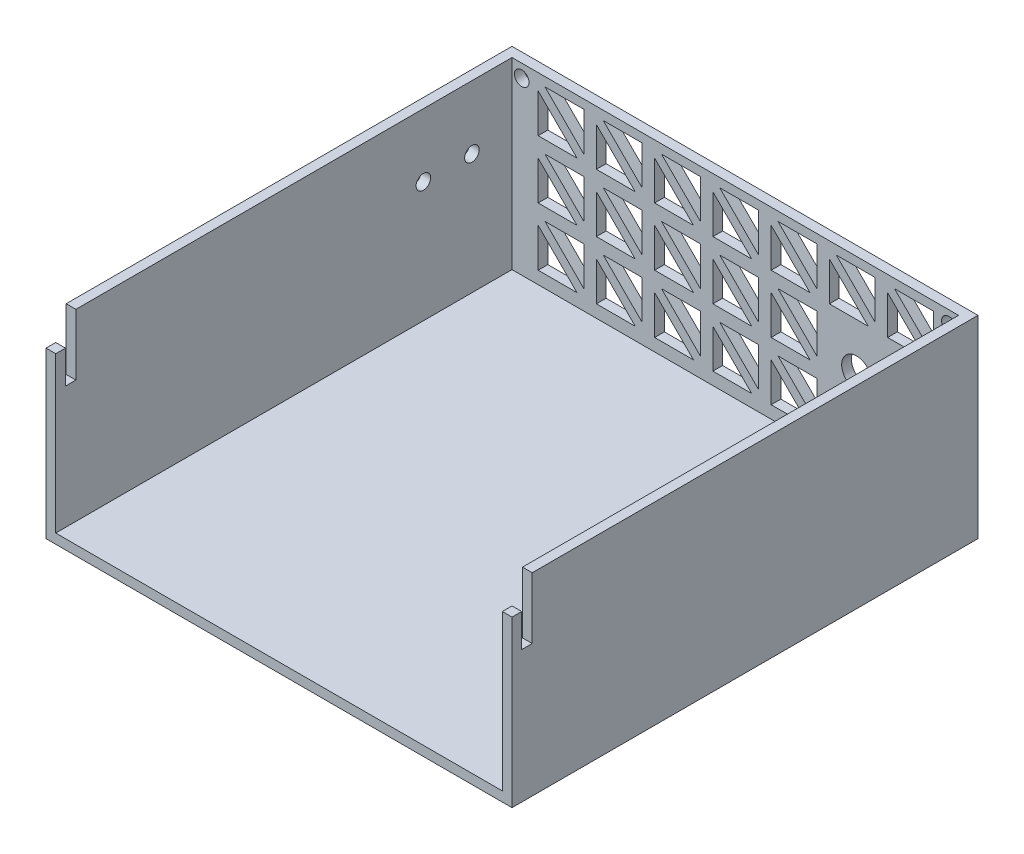
from build123d import *

# Parameters (mm, degrees)
SKETCH1_W           = 152.4
SKETCH1_H           = 152.4
BOSS_EXTRUDE1_DEPTH = 247.65
SHELL1_T            = -3.175
SKETCH3_W           = 152.4
SKETCH3_H           = 3.4798
SKETCH3_H_2         = 4.064
CUT_EXTRUDE1_DEPTH  = 117.475
SKETCH4_W           = 6.604
SKETCH4_H           = 6.7564
SKETCH4_W_2         = 3.429
SKETCH4_H_2         = 10.7696
CUT_EXTRUDE2_DEPTH  = 329.30175525
CUT_EXTRUDE3_REACH  = 330.302
SKETCH5_R           = 4.8895
CUT_EXTRUDE4_DEPTH  = 3.175
CUT_EXTRUDE5_REACH  = 330.302
SKETCH7_R           = 2.38125
SKETCH7_2_R         = 2.38125
CUT_EXTRUDE6_DEPTH  = 329.30175525
SKETCH8_R           = 2.38125
CUT_EXTRUDE8_DEPTH  = 327.839996214
SKETCH9_W           = 186.937602099
SKETCH9_H           = 189.555736562
CUT_EXTRUDE9_DEPTH  = 329.30175525


with BuildPart() as part:
    # Sketch1 → Boss-Extrude1 (new body)
    with BuildSketch(Plane(origin=(0, 0, 0), x_dir=(1, 0, 0), z_dir=(0, 1, 0))):
        with Locations((76.2, 76.2)):
            Rectangle(SKETCH1_W, SKETCH1_H)
    extrude(amount=BOSS_EXTRUDE1_DEPTH)

    # Shell1
    shell1_openings = [part.faces().sort_by_distance(p)[0] for p in [
        (76.2, 247.65, -76.2),
        (76.2, 123.825, 0),
    ]]
    offset(amount=SHELL1_T, openings=shell1_openings, kind=Kind.INTERSECTION)

    # Sketch3 → Cut-Extrude1 (cut)
    with BuildSketch(Plane.XY.offset(-117.475)):
        with Locations((76.2, 68.4149)):
            Rectangle(SKETCH3_W, SKETCH3_H)
        with Locations((76.2, 238.8616)):
            Rectangle(SKETCH3_W, SKETCH3_H_2)
        with Locations((76.2, 193.8147)):
            Rectangle(SKETCH3_W, SKETCH3_H)
    extrude(amount=CUT_EXTRUDE1_DEPTH, mode=Mode.SUBTRACT)

    # Sketch4 → Cut-Extrude2 (cut, through all)
    with BuildSketch(Plane(origin=(152.4, 0, 0), x_dir=(0, 0, -1), z_dir=(1, 0, 0))):
        with Locations((3.302, 244.2718)):
            Rectangle(SKETCH4_W, SKETCH4_H)
        with Locations((4.8895, 231.4448)):
            Rectangle(SKETCH4_W_2, SKETCH4_H_2)
        Polygon((6.604, 66.675), (6.604, 43.2054), (3.175, 43.2054), (3.175, 53.975), (0, 53.975), (0, 66.675), align=None)
        Polygon((3.175, 147.32), (3.175, 137.16), (6.604, 137.16), (6.604, 160.528), (0, 160.528), (0, 147.32), align=None)
    extrude(amount=-CUT_EXTRUDE2_DEPTH, mode=Mode.SUBTRACT)

    # Sketch5 → Cut-Extrude3 (cut, up to next)
    with BuildSketch(Plane(origin=(0, 0, -152.4), x_dir=(-1, 0, 0), z_dir=(0, 0, -1)), mode=Mode.PRIVATE) as cut_extrude3_sk1:
        with Locations((-115.8748, 30.1752)):
            Circle(SKETCH5_R)
    cut_extrude3_tool1 = extrude(cut_extrude3_sk1.sketch, amount=-CUT_EXTRUDE3_REACH, mode=Mode.PRIVATE) & part.part
    add(cut_extrude3_tool1.solids().sort_by_distance((115.8748, 30.1752, -152.4))[0], mode=Mode.SUBTRACT)

    # Sketch6 → Cut-Extrude4 (cut)
    with BuildSketch(Plane.XY.offset(-149.225)):
        Polygon((140.97, 192.0748), (140.97, 179.3748), (128.27, 192.0748), align=None)
        Polygon((138.72493597, 177.12973597), (126.02493597, 189.82973597), (126.02493597, 177.12973597), align=None)
        Polygon((140.97, 174.2948), (140.97, 161.5948), (128.27, 174.2948), align=None)
        Polygon((138.72493597, 159.34973597), (126.02493597, 172.04973597), (126.02493597, 159.34973597), align=None)
        Polygon((140.97, 156.5148), (140.97, 143.8148), (128.27, 156.5148), align=None)
        Polygon((138.72493597, 141.56973597), (126.02493597, 154.26973597), (126.02493597, 141.56973597), align=None)
        Polygon((140.97, 138.7348), (140.97, 126.0348), (128.27, 138.7348), align=None)
        Polygon((138.72493597, 123.78973597), (126.02493597, 136.48973597), (126.02493597, 123.78973597), align=None)
        Polygon((140.97, 120.9548), (140.97, 108.2548), (128.27, 120.9548), align=None)
        Polygon((138.72493597, 106.00973597), (126.02493597, 118.70973597), (126.02493597, 106.00973597), align=None)
        Polygon((140.97, 103.1748), (140.97, 90.4748), (128.27, 103.1748), align=None)
        Polygon((138.72493597, 88.22973597), (126.02493597, 100.92973597), (126.02493597, 88.22973597), align=None)
        Polygon((140.97, 85.3948), (140.97, 72.6948), (128.27, 85.3948), align=None)
        Polygon((138.72493597, 70.44973597), (126.02493597, 83.14973597), (126.02493597, 70.44973597), align=None)
        Polygon((121.92, 192.0748), (121.92, 179.3748), (109.22, 192.0748), align=None)
        Polygon((119.67493597, 177.12973597), (106.97493597, 189.82973597), (106.97493597, 177.12973597), align=None)
        Polygon((121.92, 174.2948), (121.92, 161.5948), (109.22, 174.2948), align=None)
        Polygon((119.67493597, 159.34973597), (106.97493597, 172.04973597), (106.97493597, 159.34973597), align=None)
        Polygon((121.92, 156.5148), (121.92, 143.8148), (109.22, 156.5148), align=None)
        Polygon((119.67493597, 141.56973597), (106.97493597, 154.26973597), (106.97493597, 141.56973597), align=None)
        Polygon((121.92, 138.7348), (121.92, 126.0348), (109.22, 138.7348), align=None)
        Polygon((119.67493597, 123.78973597), (106.97493597, 136.48973597), (106.97493597, 123.78973597), align=None)
        Polygon((121.92, 120.9548), (121.92, 108.2548), (109.22, 120.9548), align=None)
        Polygon((119.67493597, 106.00973597), (106.97493597, 118.70973597), (106.97493597, 106.00973597), align=None)
        Polygon((121.92, 103.1748), (121.92, 90.4748), (109.22, 103.1748), align=None)
        Polygon((119.67493597, 88.22973597), (106.97493597, 100.92973597), (106.97493597, 88.22973597), align=None)
        Polygon((121.92, 85.3948), (121.92, 72.6948), (109.22, 85.3948), align=None)
        Polygon((119.67493597, 70.44973597), (106.97493597, 83.14973597), (106.97493597, 70.44973597), align=None)
        Polygon((102.87, 192.0748), (102.87, 179.3748), (90.17, 192.0748), align=None)
        Polygon((100.62493597, 177.12973597), (87.92493597, 189.82973597), (87.92493597, 177.12973597), align=None)
        Polygon((102.87, 174.2948), (102.87, 161.5948), (90.17, 174.2948), align=None)
        Polygon((100.62493597, 159.34973597), (87.92493597, 172.04973597), (87.92493597, 159.34973597), align=None)
        Polygon((102.87, 156.5148), (102.87, 143.8148), (90.17, 156.5148), align=None)
        Polygon((100.62493597, 141.56973597), (87.92493597, 154.26973597), (87.92493597, 141.56973597), align=None)
        Polygon((102.87, 138.7348), (102.87, 126.0348), (90.17, 138.7348), align=None)
        Polygon((100.62493597, 123.78973597), (87.92493597, 136.48973597), (87.92493597, 123.78973597), align=None)
        Polygon((102.87, 120.9548), (102.87, 108.2548), (90.17, 120.9548), align=None)
        Polygon((100.62493597, 106.00973597), (87.92493597, 118.70973597), (87.92493597, 106.00973597), align=None)
        Polygon((102.87, 103.1748), (102.87, 90.4748), (90.17, 103.1748), align=None)
        Polygon((100.62493597, 88.22973597), (87.92493597, 100.92973597), (87.92493597, 88.22973597), align=None)
        Polygon((102.87, 85.3948), (102.87, 72.6948), (90.17, 85.3948), align=None)
        Polygon((100.62493597, 70.44973597), (87.92493597, 83.14973597), (87.92493597, 70.44973597), align=None)
        Polygon((83.82, 192.0748), (83.82, 179.3748), (71.12, 192.0748), align=None)
        Polygon((81.57493597, 177.12973597), (68.87493597, 189.82973597), (68.87493597, 177.12973597), align=None)
        Polygon((83.82, 174.2948), (83.82, 161.5948), (71.12, 174.2948), align=None)
        Polygon((81.57493597, 159.34973597), (68.87493597, 172.04973597), (68.87493597, 159.34973597), align=None)
        Polygon((83.82, 156.5148), (83.82, 143.8148), (71.12, 156.5148), align=None)
        Polygon((81.57493597, 141.56973597), (68.87493597, 154.26973597), (68.87493597, 141.56973597), align=None)
        Polygon((83.82, 138.7348), (83.82, 126.0348), (71.12, 138.7348), align=None)
        Polygon((81.57493597, 123.78973597), (68.87493597, 136.48973597), (68.87493597, 123.78973597), align=None)
        Polygon((83.82, 120.9548), (83.82, 108.2548), (71.12, 120.9548), align=None)
        Polygon((81.57493597, 106.00973597), (68.87493597, 118.70973597), (68.87493597, 106.00973597), align=None)
        Polygon((83.82, 103.1748), (83.82, 90.4748), (71.12, 103.1748), align=None)
        Polygon((81.57493597, 88.22973597), (68.87493597, 100.92973597), (68.87493597, 88.22973597), align=None)
        Polygon((83.82, 85.3948), (83.82, 72.6948), (71.12, 85.3948), align=None)
        Polygon((81.57493597, 70.44973597), (68.87493597, 83.14973597), (68.87493597, 70.44973597), align=None)
        Polygon((64.77, 192.0748), (64.77, 179.3748), (52.07, 192.0748), align=None)
        Polygon((62.52493597, 177.12973597), (49.82493597, 189.82973597), (49.82493597, 177.12973597), align=None)
        Polygon((64.77, 174.2948), (64.77, 161.5948), (52.07, 174.2948), align=None)
        Polygon((62.52493597, 159.34973597), (49.82493597, 172.04973597), (49.82493597, 159.34973597), align=None)
        Polygon((64.77, 156.5148), (64.77, 143.8148), (52.07, 156.5148), align=None)
        Polygon((62.52493597, 141.56973597), (49.82493597, 154.26973597), (49.82493597, 141.56973597), align=None)
        Polygon((64.77, 138.7348), (64.77, 126.0348), (52.07, 138.7348), align=None)
        Polygon((62.52493597, 123.78973597), (49.82493597, 136.48973597), (49.82493597, 123.78973597), align=None)
        Polygon((64.77, 120.9548), (64.77, 108.2548), (52.07, 120.9548), align=None)
        Polygon((62.52493597, 106.00973597), (49.82493597, 118.70973597), (49.82493597, 106.00973597), align=None)
        Polygon((64.77, 103.1748), (64.77, 90.4748), (52.07, 103.1748), align=None)
        Polygon((62.52493597, 88.22973597), (49.82493597, 100.92973597), (49.82493597, 88.22973597), align=None)
        Polygon((64.77, 85.3948), (64.77, 72.6948), (52.07, 85.3948), align=None)
        Polygon((62.52493597, 70.44973597), (49.82493597, 83.14973597), (49.82493597, 70.44973597), align=None)
        Polygon((45.72, 192.0748), (45.72, 179.3748), (33.02, 192.0748), align=None)
        Polygon((43.47493597, 177.12973597), (30.77493597, 189.82973597), (30.77493597, 177.12973597), align=None)
        Polygon((45.72, 174.2948), (45.72, 161.5948), (33.02, 174.2948), align=None)
        Polygon((43.47493597, 159.34973597), (30.77493597, 172.04973597), (30.77493597, 159.34973597), align=None)
        Polygon((45.72, 156.5148), (45.72, 143.8148), (33.02, 156.5148), align=None)
        Polygon((43.47493597, 141.56973597), (30.77493597, 154.26973597), (30.77493597, 141.56973597), align=None)
        Polygon((45.72, 138.7348), (45.72, 126.0348), (33.02, 138.7348), align=None)
        Polygon((43.47493597, 123.78973597), (30.77493597, 136.48973597), (30.77493597, 123.78973597), align=None)
        Polygon((45.72, 120.9548), (45.72, 108.2548), (33.02, 120.9548), align=None)
        Polygon((43.47493597, 106.00973597), (30.77493597, 118.70973597), (30.77493597, 106.00973597), align=None)
        Polygon((45.72, 103.1748), (45.72, 90.4748), (33.02, 103.1748), align=None)
        Polygon((43.47493597, 88.22973597), (30.77493597, 100.92973597), (30.77493597, 88.22973597), align=None)
        Polygon((45.72, 85.3948), (45.72, 72.6948), (33.02, 85.3948), align=None)
        Polygon((43.47493597, 70.44973597), (30.77493597, 83.14973597), (30.77493597, 70.44973597), align=None)
        Polygon((26.67, 192.0748), (26.67, 179.3748), (13.97, 192.0748), align=None)
        Polygon((24.42493597, 177.12973597), (11.72493597, 189.82973597), (11.72493597, 177.12973597), align=None)
        Polygon((26.67, 174.2948), (26.67, 161.5948), (13.97, 174.2948), align=None)
        Polygon((24.42493597, 159.34973597), (11.72493597, 172.04973597), (11.72493597, 159.34973597), align=None)
        Polygon((26.67, 156.5148), (26.67, 143.8148), (13.97, 156.5148), align=None)
        Polygon((24.42493597, 141.56973597), (11.72493597, 154.26973597), (11.72493597, 141.56973597), align=None)
        Polygon((26.67, 138.7348), (26.67, 126.0348), (13.97, 138.7348), align=None)
        Polygon((24.42493597, 123.78973597), (11.72493597, 136.48973597), (11.72493597, 123.78973597), align=None)
        Polygon((26.67, 120.9548), (26.67, 108.2548), (13.97, 120.9548), align=None)
        Polygon((24.42493597, 106.00973597), (11.72493597, 118.70973597), (11.72493597, 106.00973597), align=None)
        Polygon((26.67, 103.1748), (26.67, 90.4748), (13.97, 103.1748), align=None)
        Polygon((24.42493597, 88.22973597), (11.72493597, 100.92973597), (11.72493597, 88.22973597), align=None)
        Polygon((26.67, 85.3948), (26.67, 72.6948), (13.97, 85.3948), align=None)
        Polygon((24.42493597, 70.44973597), (11.72493597, 83.14973597), (11.72493597, 70.44973597), align=None)
        Polygon((140.97, 60.325), (140.97, 47.625), (128.27, 60.325), align=None)
        Polygon((126.02493597, 58.07993597), (126.02493597, 45.37993597), (138.72493597, 45.37993597), align=None)
        Polygon((121.92, 60.325), (121.92, 47.625), (109.22, 60.325), align=None)
        Polygon((106.97493597, 58.07993597), (106.97493597, 45.37993597), (119.67493597, 45.37993597), align=None)
        Polygon((102.87, 60.325), (102.87, 47.625), (90.17, 60.325), align=None)
        Polygon((87.92493597, 58.07993597), (87.92493597, 45.37993597), (100.62493597, 45.37993597), align=None)
        Polygon((83.82, 60.325), (83.82, 47.625), (71.12, 60.325), align=None)
        Polygon((68.87493597, 58.07993597), (68.87493597, 45.37993597), (81.57493597, 45.37993597), align=None)
        Polygon((64.77, 60.325), (64.77, 47.625), (52.07, 60.325), align=None)
        Polygon((49.82493597, 58.07993597), (49.82493597, 45.37993597), (62.52493597, 45.37993597), align=None)
        Polygon((45.72, 60.325), (45.72, 47.625), (33.02, 60.325), align=None)
        Polygon((30.77493597, 58.07993597), (30.77493597, 45.37993597), (43.47493597, 45.37993597), align=None)
        Polygon((26.67, 60.325), (26.67, 47.625), (13.97, 60.325), align=None)
        Polygon((11.72493597, 58.07993597), (11.72493597, 45.37993597), (24.42493597, 45.37993597), align=None)
        Polygon((102.87, 41.275), (102.87, 28.575), (90.17, 41.275), align=None)
        Polygon((87.92493597, 39.02993597), (87.92493597, 26.32993597), (100.62493597, 26.32993597), align=None)
        Polygon((83.82, 41.275), (83.82, 28.575), (71.12, 41.275), align=None)
        Polygon((68.87493597, 39.02993597), (68.87493597, 26.32993597), (81.57493597, 26.32993597), align=None)
        Polygon((64.77, 41.275), (64.77, 28.575), (52.07, 41.275), align=None)
        Polygon((49.82493597, 39.02993597), (49.82493597, 26.32993597), (62.52493597, 26.32993597), align=None)
        Polygon((45.72, 41.275), (45.72, 28.575), (33.02, 41.275), align=None)
        Polygon((30.77493597, 39.02993597), (30.77493597, 26.32993597), (43.47493597, 26.32993597), align=None)
        Polygon((26.67, 41.275), (26.67, 28.575), (13.97, 41.275), align=None)
        Polygon((11.72493597, 39.02993597), (11.72493597, 26.32993597), (24.42493597, 26.32993597), align=None)
        Polygon((126.02493597, 26.32993597), (138.72493597, 26.32993597), (126.02493597, 39.02993597), align=None)
        Polygon((140.97, 28.575), (128.27, 41.275), (140.97, 41.275), align=None)
        Polygon((102.87, 22.225), (102.87, 9.525), (90.17, 22.225), align=None)
        Polygon((87.92493597, 19.97993597), (87.92493597, 7.27993597), (100.62493597, 7.27993597), align=None)
        Polygon((83.82, 22.225), (83.82, 9.525), (71.12, 22.225), align=None)
        Polygon((68.87493597, 19.97993597), (68.87493597, 7.27993597), (81.57493597, 7.27993597), align=None)
        Polygon((64.77, 22.225), (64.77, 9.525), (52.07, 22.225), align=None)
        Polygon((49.82493597, 19.97993597), (49.82493597, 7.27993597), (62.52493597, 7.27993597), align=None)
        Polygon((45.72, 22.225), (45.72, 9.525), (33.02, 22.225), align=None)
        Polygon((30.77493597, 19.97993597), (30.77493597, 7.27993597), (43.47493597, 7.27993597), align=None)
        Polygon((26.67, 22.225), (26.67, 9.525), (13.97, 22.225), align=None)
        Polygon((11.72493597, 19.97993597), (11.72493597, 7.27993597), (24.42493597, 7.27993597), align=None)
        Polygon((126.02493597, 7.27993597), (138.72493597, 7.27993597), (126.02493597, 19.97993597), align=None)
        Polygon((140.97, 9.525), (128.27, 22.225), (140.97, 22.225), align=None)
    extrude(amount=-CUT_EXTRUDE4_DEPTH, mode=Mode.SUBTRACT)

    # Sketch7 → Cut-Extrude5 (cut, up to next)
    with BuildSketch(Plane.ZY, mode=Mode.PRIVATE) as cut_extrude5_sk1:
        with Locations((-136.110990874, 217.7796)):
            Circle(SKETCH7_R)
    cut_extrude5_tool1 = extrude(cut_extrude5_sk1.sketch, amount=-CUT_EXTRUDE5_REACH, mode=Mode.PRIVATE) & part.part
    # Sketch7 → Cut-Extrude5 (cut, up to next)
    with BuildSketch(Plane.ZY, mode=Mode.PRIVATE) as cut_extrude5_sk2:
        with Locations((-120.235990874, 217.7796)):
            Circle(SKETCH7_R)
    cut_extrude5_tool2 = extrude(cut_extrude5_sk2.sketch, amount=-CUT_EXTRUDE5_REACH, mode=Mode.PRIVATE) & part.part
    # Sketch7 → Cut-Extrude5 (cut, up to next)
    with BuildSketch(Plane.ZY, mode=Mode.PRIVATE) as cut_extrude5_sk3:
        with Locations((-136.110990874, 159.3596)):
            Circle(SKETCH7_R)
    cut_extrude5_tool3 = extrude(cut_extrude5_sk3.sketch, amount=-CUT_EXTRUDE5_REACH, mode=Mode.PRIVATE) & part.part
    # Sketch7 → Cut-Extrude5 (cut, up to next)
    with BuildSketch(Plane.ZY, mode=Mode.PRIVATE) as cut_extrude5_sk4:
        with Locations((-120.235990874, 159.3596)):
            Circle(SKETCH7_R)
    cut_extrude5_tool4 = extrude(cut_extrude5_sk4.sketch, amount=-CUT_EXTRUDE5_REACH, mode=Mode.PRIVATE) & part.part
    # Sketch7 → Cut-Extrude5 (cut, up to next)
    with BuildSketch(Plane.ZY, mode=Mode.PRIVATE) as cut_extrude5_sk5:
        with Locations((-136.110990874, 100.9396)):
            Circle(SKETCH7_R)
    cut_extrude5_tool5 = extrude(cut_extrude5_sk5.sketch, amount=-CUT_EXTRUDE5_REACH, mode=Mode.PRIVATE) & part.part
    # Sketch7 → Cut-Extrude5 (cut, up to next)
    with BuildSketch(Plane.ZY, mode=Mode.PRIVATE) as cut_extrude5_sk6:
        with Locations((-120.235990874, 100.9396)):
            Circle(SKETCH7_R)
    cut_extrude5_tool6 = extrude(cut_extrude5_sk6.sketch, amount=-CUT_EXTRUDE5_REACH, mode=Mode.PRIVATE) & part.part
    # Sketch7 → Cut-Extrude5 (cut, up to next)
    with BuildSketch(Plane.ZY, mode=Mode.PRIVATE) as cut_extrude5_sk7:
        with Locations((-136.110990874, 42.5196)):
            Circle(SKETCH7_R)
    cut_extrude5_tool7 = extrude(cut_extrude5_sk7.sketch, amount=-CUT_EXTRUDE5_REACH, mode=Mode.PRIVATE) & part.part
    # Sketch7 → Cut-Extrude5 (cut, up to next)
    with BuildSketch(Plane.ZY, mode=Mode.PRIVATE) as cut_extrude5_sk8:
        with Locations((-120.235990874, 42.5196)):
            Circle(SKETCH7_R)
    cut_extrude5_tool8 = extrude(cut_extrude5_sk8.sketch, amount=-CUT_EXTRUDE5_REACH, mode=Mode.PRIVATE) & part.part
    # Sketch7 → Cut-Extrude5 (cut, up to next)
    with BuildSketch(Plane.ZY, mode=Mode.PRIVATE) as cut_extrude5_sk9:
        with Locations((-15.875, 183.1848)):
            Circle(SKETCH7_R)
    cut_extrude5_tool9 = extrude(cut_extrude5_sk9.sketch, amount=-CUT_EXTRUDE5_REACH, mode=Mode.PRIVATE) & part.part
    # Sketch7 → Cut-Extrude5 (cut, up to next)
    with BuildSketch(Plane.ZY, mode=Mode.PRIVATE) as cut_extrude5_sk10:
        with Locations((-15.875, 175.5648)):
            Circle(SKETCH7_R)
    cut_extrude5_tool10 = extrude(cut_extrude5_sk10.sketch, amount=-CUT_EXTRUDE5_REACH, mode=Mode.PRIVATE) & part.part
    # Sketch7 → Cut-Extrude5 (cut, up to next)
    with BuildSketch(Plane.ZY, mode=Mode.PRIVATE) as cut_extrude5_sk11:
        with Locations((-15.875, 78.4098)):
            Circle(SKETCH7_R)
    cut_extrude5_tool11 = extrude(cut_extrude5_sk11.sketch, amount=-CUT_EXTRUDE5_REACH, mode=Mode.PRIVATE) & part.part
    # Sketch7 → Cut-Extrude5 (cut, up to next)
    with BuildSketch(Plane.ZY, mode=Mode.PRIVATE) as cut_extrude5_sk12:
        with Locations((-15.875, 86.0298)):
            Circle(SKETCH7_R)
    cut_extrude5_tool12 = extrude(cut_extrude5_sk12.sketch, amount=-CUT_EXTRUDE5_REACH, mode=Mode.PRIVATE) & part.part
    add(cut_extrude5_tool1.solids().sort_by_distance((0, 217.7796, -136.110991))[0], mode=Mode.SUBTRACT)
    add(cut_extrude5_tool2.solids().sort_by_distance((0, 217.7796, -120.235991))[0], mode=Mode.SUBTRACT)
    add(cut_extrude5_tool3.solids().sort_by_distance((0, 159.3596, -136.110991))[0], mode=Mode.SUBTRACT)
    add(cut_extrude5_tool4.solids().sort_by_distance((0, 159.3596, -120.235991))[0], mode=Mode.SUBTRACT)
    add(cut_extrude5_tool5.solids().sort_by_distance((0, 100.9396, -136.110991))[0], mode=Mode.SUBTRACT)
    add(cut_extrude5_tool6.solids().sort_by_distance((0, 100.9396, -120.235991))[0], mode=Mode.SUBTRACT)
    add(cut_extrude5_tool7.solids().sort_by_distance((0, 42.5196, -136.110991))[0], mode=Mode.SUBTRACT)
    add(cut_extrude5_tool8.solids().sort_by_distance((0, 42.5196, -120.235991))[0], mode=Mode.SUBTRACT)
    add(cut_extrude5_tool9.solids().sort_by_distance((0, 183.1848, -15.875))[0], mode=Mode.SUBTRACT)
    add(cut_extrude5_tool10.solids().sort_by_distance((0, 175.5648, -15.875))[0], mode=Mode.SUBTRACT)
    add(cut_extrude5_tool11.solids().sort_by_distance((0, 78.4098, -15.875))[0], mode=Mode.SUBTRACT)
    add(cut_extrude5_tool12.solids().sort_by_distance((0, 86.0298, -15.875))[0], mode=Mode.SUBTRACT)

    # Sketch7<2> → Cut-Extrude6 (cut, through all)
    with BuildSketch(Plane.ZY):
        with Locations((-15.875, 183.1848)):
            Circle(SKETCH7_2_R)
        with Locations((-15.875, 175.5648)):
            Circle(SKETCH7_2_R)
        with Locations((-15.875, 78.4098)):
            Circle(SKETCH7_2_R)
        with Locations((-15.875, 86.0298)):
            Circle(SKETCH7_2_R)
    extrude(amount=-CUT_EXTRUDE6_DEPTH, mode=Mode.SUBTRACT)

    # Sketch8 → Cut-Extrude8 (cut, through all)
    with BuildSketch(Plane.XY.offset(-149.225)):
        with Locations((6.35, 68.5165)):
            Circle(SKETCH8_R)
        with Locations((6.35, 58.9915)):
            Circle(SKETCH8_R)
        with Locations((146.05, 58.9915)):
            Circle(SKETCH8_R)
        with Locations((146.05, 68.5165)):
            Circle(SKETCH8_R)
    extrude(amount=-CUT_EXTRUDE8_DEPTH, mode=Mode.SUBTRACT)

    # Sketch9 → Cut-Extrude9 (cut, through all)
    with BuildSketch(Plane.XY):
        with Locations((58.931198951, 158.023868281)):
            Rectangle(SKETCH9_W, SKETCH9_H)
    extrude(amount=-CUT_EXTRUDE9_DEPTH, mode=Mode.SUBTRACT)


solid = part.part
